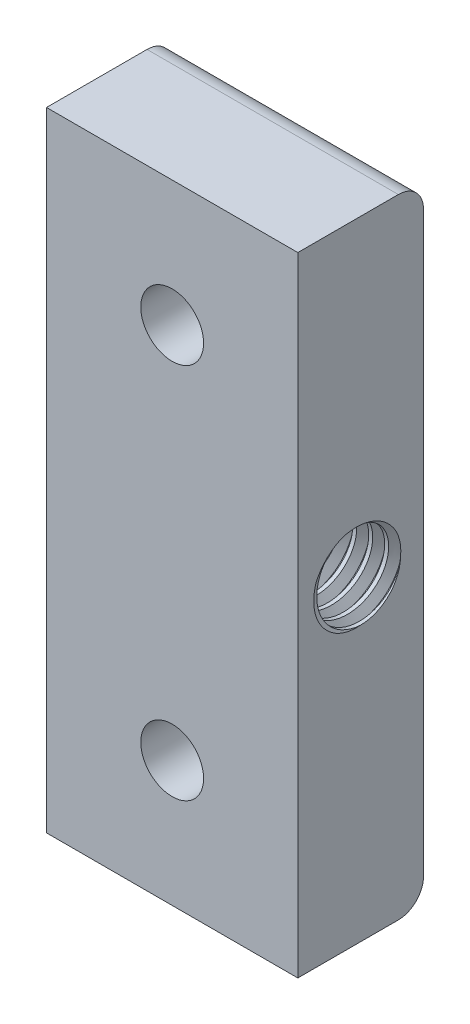
from build123d import *

# Parameters (mm, degrees)
SKETCH1_W               = 20
SKETCH1_H               = 50
SKETCH1_R               = 2.5
BOSS_EXTRUDE1_DEPTH     = 10
CUT_EXTRUDE1_DEPTH      = 10
CUT_EXTRUDE1_DEPTH_BACK = 10
SKETCH2_R               = 3.175
FILLET1_R               = 2
THREAD1_PITCH           = 1.27


with BuildPart() as part:
    # Sketch1 → Boss-Extrude1 (new body)
    with BuildSketch(Plane.XY):
        Rectangle(SKETCH1_W, SKETCH1_H)
        with Locations((0, 15)):
            Circle(SKETCH1_R, mode=Mode.SUBTRACT)
        with Locations((0, -15)):
            Circle(SKETCH1_R, mode=Mode.SUBTRACT)
    extrude(amount=BOSS_EXTRUDE1_DEPTH)

    # Sketch2 → Cut-Extrude1 (cut, two sides: drawn at the far end of the back side and taken through both)
    with BuildSketch(Plane(origin=(0, 0, 0), x_dir=(0, 0, -1), z_dir=(1, 0, 0)).offset(-CUT_EXTRUDE1_DEPTH_BACK)):
        with Locations((-5, 0)):
            Circle(SKETCH2_R)
    extrude(amount=CUT_EXTRUDE1_DEPTH + CUT_EXTRUDE1_DEPTH_BACK, mode=Mode.SUBTRACT)

    # Fillet1
    fillet1_edges = [part.edges().sort_by_distance(p)[0] for p in [
        (0, 25, 0),
        (0, -25, 0),
    ]]
    fillet(fillet1_edges, radius=FILLET1_R)

    # Thread1: the profile of Thread Profile1 profile screwed along a right-hand helix of 23.622047 turns, 8 arcs to a turn; built about Z, then put on its axis
    thread1_z = Axis((0, 0, 0), (0, 0, 1))
    thread1_corners = [(3.1747, 0, -0.000173205), (3.862407661, 0, 0.396874998), (3.862407661, 0, 0.555624998), (3.1747, 0, 0.952673202)]
    with BuildLine(mode=Mode.PRIVATE) as thread1_profile:
        Line(thread1_corners[0], thread1_corners[1])
        Line(thread1_corners[1], thread1_corners[2])
        Line(thread1_corners[2], thread1_corners[3])
        Line(thread1_corners[3], thread1_corners[0])
    thread1_cap = Face(thread1_profile.wire())
    thread1_turn_angles = [0, 22.5, 45, 67.5, 90, 112.5, 135, 157.5, 180, 202.5, 225, 247.5, 270, 292.5, 315, 337.5, 360]
    thread1_turn_weights = [1, 0.9238795325112867, 1, 0.9238795325112867, 1, 0.9238795325112867, 1, 0.9238795325112867, 1, 0.9238795325112867, 1, 0.9238795325112867, 1, 0.9238795325112867, 1, 0.9238795325112867, 1]
    thread1_turn_rails = [Edge.make_bspline([Vector(p[0], p[1], 0).rotate(thread1_z, thread1_turn_angles[k]) / thread1_turn_weights[k] + Vector(0, 0, p[2] + THREAD1_PITCH * thread1_turn_angles[k] / 360) for k in range(17)], [0, 0, 0, 1, 1, 2, 2, 3, 3, 4, 4, 5, 5, 6, 6, 7, 7, 8, 8, 8], 2, thread1_turn_weights) for p in thread1_corners]
    thread1_turn_sides = [Face.make_surface_from_curves(thread1_turn_rails[p[0]], thread1_turn_rails[p[1]]) for p in [(0, 1), (1, 2), (2, 3), (3, 0)]]
    thread1_last_angles = [8280, 8302.5, 8325, 8347.5, 8370, 8392.5, 8415, 8437.5, 8460, 8481.968503937, 8503.937007874]
    thread1_last_weights = [1, 0.9238795325112867, 1, 0.9238795325112867, 1, 0.9238795325112867, 1, 0.9238795325112867, 1, 0.9273896394584102, 1]
    thread1_last_rails = [Edge.make_bspline([Vector(p[0], p[1], 0).rotate(thread1_z, thread1_last_angles[k]) / thread1_last_weights[k] + Vector(0, 0, p[2] + THREAD1_PITCH * thread1_last_angles[k] / 360) for k in range(11)], [0, 0, 0, 1, 1, 2, 2, 3, 3, 4, 4, 5, 5, 5], 2, thread1_last_weights) for p in thread1_corners]
    thread1_last_sides = [Face.make_surface_from_curves(thread1_last_rails[p[0]], thread1_last_rails[p[1]]) for p in [(0, 1), (1, 2), (2, 3), (3, 0)]]
    thread1 = Plane(origin=(-10, 0, 5), x_dir=(0, 0, -1), z_dir=(1, 0, 0)) * Solid(Shell([*[p.moved(Location((0, 0, THREAD1_PITCH * i))) for i in range(23) for p in thread1_turn_sides], *thread1_last_sides, thread1_cap, thread1_cap.rotate(thread1_z, 8503.937007874).moved(Location((0, 0, THREAD1_PITCH * 8503.937007874 / 360)))]))
    add(thread1, mode=Mode.SUBTRACT)


solid = part.part
